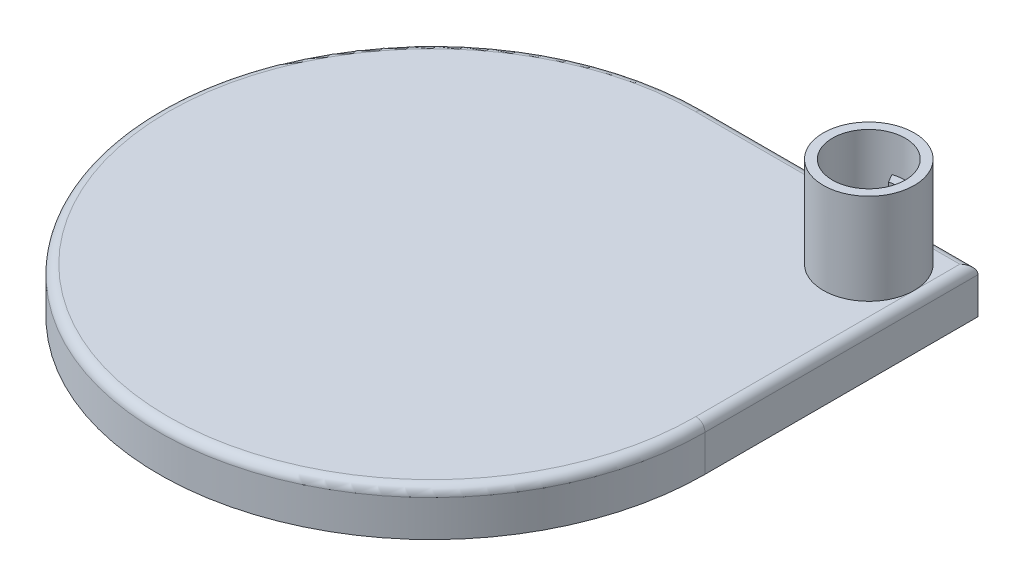
from build123d import *

# Parameters (mm, degrees)
BOSS_EXTRUDE1_DEPTH = 6.35
SKETCH2_R           = 6.35
SKETCH2_R_2         = 5.08
BOSS_EXTRUDE2_DEPTH = 12.7
BOSS_EXTRUDE3_START = 5.08
BOSS_EXTRUDE3_DEPTH = 2.54
FILLET1_R           = 1.27


with BuildPart() as part:
    # Sketch1 → Boss-Extrude1 (new body)
    with BuildSketch(Plane(origin=(0, 0, 0), x_dir=(1, 0, 0), z_dir=(0, 1, 0))):
        with BuildLine():
            Line((0, 0), (-38.1, 0))
            ThreePointArc((-38.1, 0), (-65.040768363, -65.040768363), (0, -38.1))
            Line((0, -38.1), (0, 0))
        make_face()
    extrude(amount=BOSS_EXTRUDE1_DEPTH)

    # Sketch2 → Boss-Extrude2 (add)
    with BuildSketch(Plane(origin=(0, 6.35, 0), x_dir=(1, 0, 0), z_dir=(0, 1, 0))):
        with Locations(Location((-7.62, -7.62, 0), (0, 0, 270))):
            Circle(SKETCH2_R)
        with Locations(Location((-7.62, -7.62, 0), (0, 0, 270))):
            Circle(SKETCH2_R_2, mode=Mode.SUBTRACT)
    extrude(amount=BOSS_EXTRUDE2_DEPTH)

    # Sketch3 → Boss-Extrude3 (add)
    with BuildSketch(Plane(origin=(0, 6.35, 0), x_dir=(1, 0, 0), z_dir=(0, 1, 0)).offset(BOSS_EXTRUDE3_START)):
        with BuildLine():
            Line((-9.216562761, -2.797408648), (-8.563437239, -3.928655235))
            ThreePointArc((-8.563437239, -3.928655235), (-7.62, -3.81), (-6.676562761, -3.928655235))
            Line((-6.676562761, -3.928655235), (-6.023437239, -2.797408648))
            ThreePointArc((-6.023437239, -2.797408648), (-7.62, -2.54), (-9.216562761, -2.797408648))
        make_face()
        with BuildLine():
            ThreePointArc((-6.676562761, -11.311344765), (-7.62, -11.43), (-8.563437239, -11.311344765))
            Line((-8.563437239, -11.311344765), (-9.216562761, -12.442591352))
            ThreePointArc((-9.216562761, -12.442591352), (-7.62, -12.7), (-6.023437239, -12.442591352))
            Line((-6.023437239, -12.442591352), (-6.676562761, -11.311344765))
        make_face()
    extrude(amount=BOSS_EXTRUDE3_DEPTH)

    # Fillet1
    fillet1_edges = [part.edges().sort_by_distance(p)[0] for p in [
        (-65.040768363, 6.35, 65.040768363),
        (0, 6.35, 19.05),
        (-19.05, 6.35, 0),
    ]]
    fillet(fillet1_edges, radius=FILLET1_R - 0.0001)  # a hair under: the kernel refuses the full size


solid = part.part
